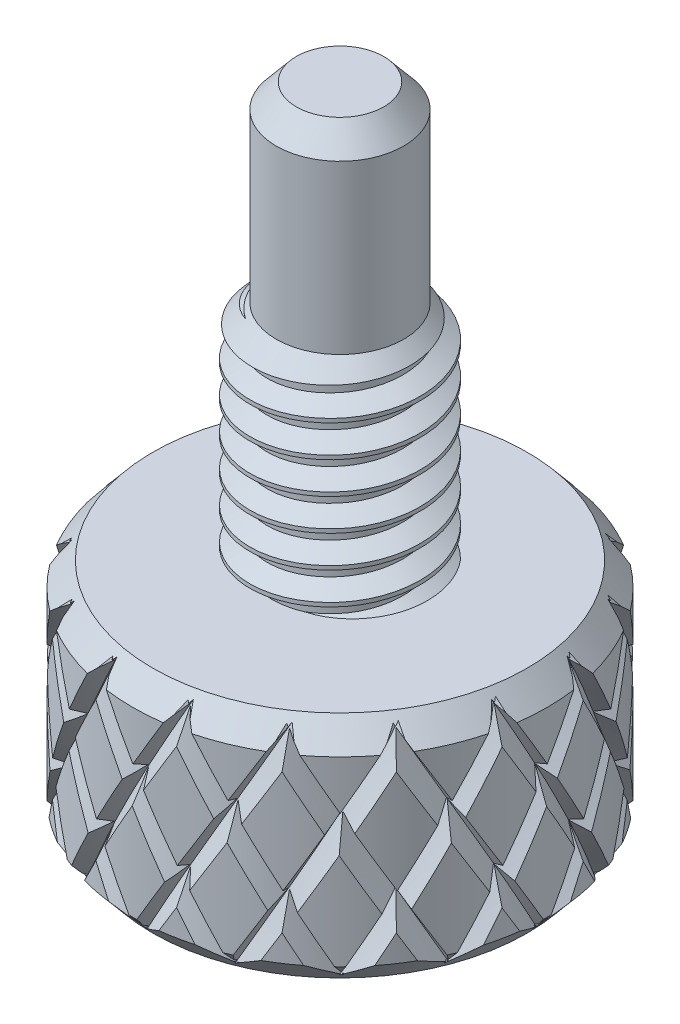
from build123d import *

# Parameters (mm, degrees)
SKETCH1_R           = 2.675
BOSS_EXTRUDE1_DEPTH = 7
CHAMFER1_SIZE       = 0.7
CUT_SWEEP1_PITCH    = 1
SKETCH4_R           = 6.5
BOSS_EXTRUDE2_DEPTH = 7.2
SKETCH5_R           = 2
BOSS_EXTRUDE3_DEPTH = 6
CHAMFER2_SIZE       = 0.75
CHAMFER2_SIZE2      = 0.629324723
CHAMFER3_SIZE       = 0.75
CHAMFER3_SIZE2      = 0.629324723
CHAMFER4_SIZE       = 0.75
CHAMFER4_SIZE2      = 0.629324723
CUT_SWEEP2_PITCH    = 70
CUT_SWEEP3_PITCH    = 70
CIRPATTERN1_COUNT   = 16


with BuildPart() as part:
    # Sketch1 → Boss-Extrude1 (new body)
    with BuildSketch(Plane(origin=(0, 0, 0), x_dir=(1, 0, 0), z_dir=(0, 1, 0))):
        with Locations(Location((0, 0, 0), (0, 0, 270))):
            Circle(SKETCH1_R)
    extrude(amount=BOSS_EXTRUDE1_DEPTH)

    # Chamfer1
    chamfer1_edges = [part.edges().sort_by_distance(p)[0] for p in [
        (0, 7, -2.675),
    ]]
    chamfer(chamfer1_edges, length=CHAMFER1_SIZE)

    # Cut-Sweep1: arcs per turn and ends read off the stored shape
    # Cut-Sweep1: the profile of Sketch3 screwed along a right-hand helix through 8.5 turns, 8 arcs to a turn; built about Z, then put on its axis
    cut_sweep1_z = Axis((0, 0, 0), (0, 0, 1))
    cut_sweep1_corners = [(2.675, 0, -1), (2.675, 0.051968128, -1.873455387), (2.133734123, 0.033408082, -1.561507035), (2.133734123, 0.018560046, -1.311948353)]
    with BuildLine(mode=Mode.PRIVATE) as cut_sweep1_profile:
        Line(cut_sweep1_corners[0], cut_sweep1_corners[1])
        Line(cut_sweep1_corners[1], cut_sweep1_corners[2])
        Line(cut_sweep1_corners[2], cut_sweep1_corners[3])
        Line(cut_sweep1_corners[3], cut_sweep1_corners[0])
    cut_sweep1_cap = Face(cut_sweep1_profile.wire())
    cut_sweep1_turn_angles = [0, 22.5, 45, 67.5, 90, 112.5, 135, 157.5, 180, 202.5, 225, 247.5, 270, 292.5, 315, 337.5, 360]
    cut_sweep1_turn_weights = [1, 0.9238795325112867, 1, 0.9238795325112867, 1, 0.9238795325112867, 1, 0.9238795325112867, 1, 0.9238795325112867, 1, 0.9238795325112867, 1, 0.9238795325112867, 1, 0.9238795325112867, 1]
    cut_sweep1_turn_rails = [Edge.make_bspline([Vector(p[0], p[1], 0).rotate(cut_sweep1_z, cut_sweep1_turn_angles[k]) / cut_sweep1_turn_weights[k] + Vector(0, 0, p[2] + CUT_SWEEP1_PITCH * cut_sweep1_turn_angles[k] / 360) for k in range(17)], [0, 0, 0, 1, 1, 2, 2, 3, 3, 4, 4, 5, 5, 6, 6, 7, 7, 8, 8, 8], 2, cut_sweep1_turn_weights) for p in cut_sweep1_corners]
    cut_sweep1_turn_sides = [Face.make_surface_from_curves(cut_sweep1_turn_rails[p[0]], cut_sweep1_turn_rails[p[1]]) for p in [(0, 1), (1, 2), (2, 3), (3, 0)]]
    cut_sweep1_last_angles = [2880, 2902.5, 2925, 2947.5, 2970, 2992.5, 3015, 3037.5, 3060]
    cut_sweep1_last_weights = [1, 0.9238795325112867, 1, 0.9238795325112867, 1, 0.9238795325112867, 1, 0.9238795325112867, 1]
    cut_sweep1_last_rails = [Edge.make_bspline([Vector(p[0], p[1], 0).rotate(cut_sweep1_z, cut_sweep1_last_angles[k]) / cut_sweep1_last_weights[k] + Vector(0, 0, p[2] + CUT_SWEEP1_PITCH * cut_sweep1_last_angles[k] / 360) for k in range(9)], [0, 0, 0, 1, 1, 2, 2, 3, 3, 4, 4, 4], 2, cut_sweep1_last_weights) for p in cut_sweep1_corners]
    cut_sweep1_last_sides = [Face.make_surface_from_curves(cut_sweep1_last_rails[p[0]], cut_sweep1_last_rails[p[1]]) for p in [(0, 1), (1, 2), (2, 3), (3, 0)]]
    cut_sweep1 = Plane(origin=(0, 0, 0), x_dir=(0, 0, -1), z_dir=(0, 1, 0)) * Solid(Shell([*[p.moved(Location((0, 0, CUT_SWEEP1_PITCH * i))) for i in range(8) for p in cut_sweep1_turn_sides], *cut_sweep1_last_sides, cut_sweep1_cap, cut_sweep1_cap.rotate(cut_sweep1_z, 3060).moved(Location((0, 0, CUT_SWEEP1_PITCH * 3060 / 360)))]))
    add(cut_sweep1, mode=Mode.SUBTRACT)

    # Sketch4 → Boss-Extrude2 (add)
    with BuildSketch(Plane(origin=(0, 0, 0), x_dir=(1, 0, 0), z_dir=(0, 1, 0))):
        Circle(SKETCH4_R)
    extrude(amount=-BOSS_EXTRUDE2_DEPTH)

    # Sketch5 → Boss-Extrude3 (add)
    with BuildSketch(Plane(origin=(0, 7, 0), x_dir=(1, 0, 0), z_dir=(0, 1, 0))):
        with Locations(Location((0, 0, 0), (0, 0, 270))):
            Circle(SKETCH5_R)
    extrude(amount=BOSS_EXTRUDE3_DEPTH)

    # Chamfer2
    chamfer2_edges = [part.edges().sort_by_distance(p)[0] for p in [
        (0, 13, -2),
    ]]
    chamfer2_side = [part.faces().sort_by_distance(p)[0] for p in [
        (0, 10, -2),
    ]]
    chamfer(chamfer2_edges, length=CHAMFER2_SIZE, length2=CHAMFER2_SIZE2, reference=chamfer2_side[0])

    # Chamfer3
    chamfer3_edges = [part.edges().sort_by_distance(p)[0] for p in [
        (-6.5, -7.2, 0),
    ]]
    chamfer3_side = [part.faces().sort_by_distance(p)[0] for p in [
        (-6.5, -3.6, 0),
    ]]
    chamfer(chamfer3_edges, length=CHAMFER3_SIZE, length2=CHAMFER3_SIZE2, reference=chamfer3_side[0])

    # Chamfer4
    chamfer4_edges = [part.edges().sort_by_distance(p)[0] for p in [
        (-6.5, 0, 0),
    ]]
    chamfer4_side = [part.faces().sort_by_distance(p)[0] for p in [
        (-6.5, -3.225, 0),
    ]]
    chamfer(chamfer4_edges, length=CHAMFER4_SIZE, length2=CHAMFER4_SIZE2, reference=chamfer4_side[0])

    # Cut-Sweep2: arcs per turn and ends read off the stored shape
    # Cut-Sweep2: the profile of Sketch10 screwed along a right-hand helix through 0.1 turns, 30 arcs to a turn; built about Z, then put on its axis
    cut_sweep2_z = Axis((0, 0, 0), (0, 0, 1))
    cut_sweep2_corners = [(6.032762103, -0.092561567, 0.054834825), (6.976790168, -0.376363906, 0.222963478), (6.790447728, 0.468925473, -0.277798303)]
    with BuildLine(mode=Mode.PRIVATE) as cut_sweep2_profile:
        Line(cut_sweep2_corners[0], cut_sweep2_corners[1])
        Line(cut_sweep2_corners[1], cut_sweep2_corners[2])
        Line(cut_sweep2_corners[2], cut_sweep2_corners[0])
    cut_sweep2_cap = Face(cut_sweep2_profile.wire())
    cut_sweep2_turn_angles = [0, 6, 12, 18, 24, 30, 36]
    cut_sweep2_turn_weights = [1, 0.9945218953682733, 1, 0.9945218953682733, 1, 0.9945218953682733, 1]
    cut_sweep2_turn_rails = [Edge.make_bspline([Vector(p[0], p[1], 0).rotate(cut_sweep2_z, cut_sweep2_turn_angles[k]) / cut_sweep2_turn_weights[k] + Vector(0, 0, p[2] + CUT_SWEEP2_PITCH * cut_sweep2_turn_angles[k] / 360) for k in range(7)], [0, 0, 0, 1, 1, 2, 2, 3, 3, 3], 2, cut_sweep2_turn_weights) for p in cut_sweep2_corners]
    cut_sweep2_turn_sides = [Face.make_surface_from_curves(cut_sweep2_turn_rails[p[0]], cut_sweep2_turn_rails[p[1]]) for p in [(0, 1), (1, 2), (2, 0)]]
    cut_sweep2 = Plane(origin=(0, -7.2, 0), x_dir=(1, 0, 0), z_dir=(0, 1, 0)) * Solid(Shell([*cut_sweep2_turn_sides, cut_sweep2_cap, cut_sweep2_cap.rotate(cut_sweep2_z, 36).moved(Location((0, 0, CUT_SWEEP2_PITCH * 36 / 360)))]))
    add(cut_sweep2, mode=Mode.SUBTRACT)

    # Cut-Sweep3: arcs per turn and ends read off the stored shape
    # Cut-Sweep3: the profile of Sketch13 screwed along a left-hand helix through 0.1 turns, 30 arcs to a turn; built about Z, then put on its axis
    cut_sweep3_z = Axis((0, 0, 0), (0, 0, 1))
    cut_sweep3_corners = [(6.056896428, 0.168533359, 0.099841625), (6.701908388, -0.488929065, -0.289648724), (7.041195184, 0.320395706, 0.189807099)]
    with BuildLine(mode=Mode.PRIVATE) as cut_sweep3_profile:
        Line(cut_sweep3_corners[0], cut_sweep3_corners[1])
        Line(cut_sweep3_corners[1], cut_sweep3_corners[2])
        Line(cut_sweep3_corners[2], cut_sweep3_corners[0])
    cut_sweep3_cap = Face(cut_sweep3_profile.wire())
    cut_sweep3_turn_angles = [0, -6, -12, -18, -24, -30, -36]
    cut_sweep3_turn_weights = [1, 0.9945218953682733, 1, 0.9945218953682733, 1, 0.9945218953682733, 1]
    cut_sweep3_turn_rails = [Edge.make_bspline([Vector(p[0], p[1], 0).rotate(cut_sweep3_z, cut_sweep3_turn_angles[k]) / cut_sweep3_turn_weights[k] + Vector(0, 0, p[2] + -CUT_SWEEP3_PITCH * cut_sweep3_turn_angles[k] / 360) for k in range(7)], [0, 0, 0, 1, 1, 2, 2, 3, 3, 3], 2, cut_sweep3_turn_weights) for p in cut_sweep3_corners]
    cut_sweep3_turn_sides = [Face.make_surface_from_curves(cut_sweep3_turn_rails[p[0]], cut_sweep3_turn_rails[p[1]]) for p in [(0, 1), (1, 2), (2, 0)]]
    cut_sweep3 = Plane(origin=(0, -7.2, 0), x_dir=(1, 0, 0), z_dir=(0, 1, 0)) * Solid(Shell([*cut_sweep3_turn_sides, cut_sweep3_cap, cut_sweep3_cap.rotate(cut_sweep3_z, -36).moved(Location((0, 0, -CUT_SWEEP3_PITCH * -36 / 360)))]))
    add(cut_sweep3, mode=Mode.SUBTRACT)

    # CirPattern1: Cut-Sweep2, Cut-Sweep3 ×16 about axis
    cirpattern1_axis = Axis((0, 13, 0), (0, 1, 0))
    add([cut_sweep2.rotate(cirpattern1_axis, i * 360 / CIRPATTERN1_COUNT) for i in range(1, CIRPATTERN1_COUNT)], mode=Mode.SUBTRACT)
    add([cut_sweep3.rotate(cirpattern1_axis, i * 360 / CIRPATTERN1_COUNT) for i in range(1, CIRPATTERN1_COUNT)], mode=Mode.SUBTRACT)


solid = part.part
